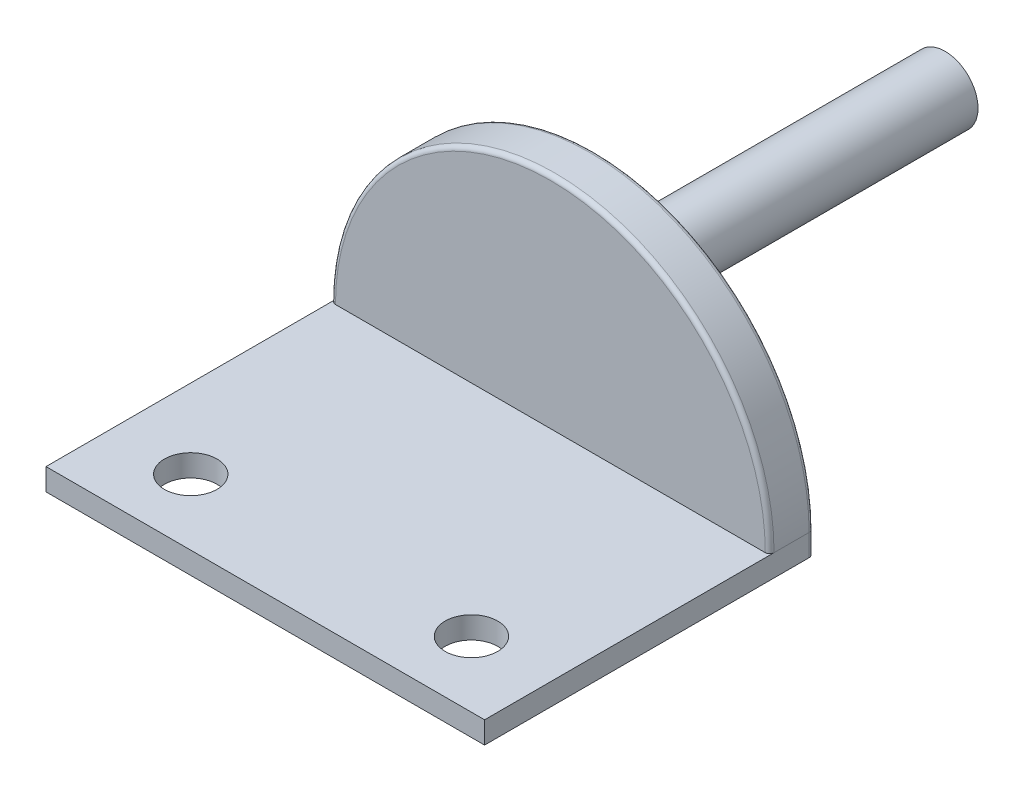
from build123d import *

# Parameters (mm, degrees)
SKETCH2_W           = 100
SKETCH2_H           = 75
SKETCH2_R           = 6
BOSS_EXTRUDE1_DEPTH = 5
SKETCH3_W           = 100
SKETCH3_H           = 10
BOSS_EXTRUDE2_DEPTH = 50
CUT_EXTRUDE2_START  = -10
CUT_EXTRUDE2_DEPTH  = 10
FILLET1_R           = 1
FILLET2_R           = 1
SKETCH6_R           = 7.5
BOSS_EXTRUDE3_DEPTH = 90


# Read off the part's stored shape, not the designer's step: Cut-Extrude2
with BuildPart() as part:
    # Sketch2 → Boss-Extrude1 (new body)
    with BuildSketch(Plane(origin=(0, 0, 0), x_dir=(1, 0, 0), z_dir=(0, 1, 0))):
        Rectangle(SKETCH2_W, SKETCH2_H)
        with Locations(Location((-32, -22.5, 0), (0, 0, 270))):
            Circle(SKETCH2_R, mode=Mode.SUBTRACT)
        with Locations(Location((32, -22.5, 0), (0, 0, 270))):
            Circle(SKETCH2_R, mode=Mode.SUBTRACT)
    extrude(amount=BOSS_EXTRUDE1_DEPTH)

    # Sketch3 → Boss-Extrude2 (add)
    with BuildSketch(Plane(origin=(0, 5, 0), x_dir=(1, 0, 0), z_dir=(0, 1, 0))):
        with Locations((0, 32.5)):
            Rectangle(SKETCH3_W, SKETCH3_H)
    extrude(amount=BOSS_EXTRUDE2_DEPTH)

    # Cut-Extrude2 outline → Cut-Extrude2 (cut)
    with BuildSketch(Plane.XY.offset(-27.5).offset(CUT_EXTRUDE2_START)):
        with BuildLine():
            Line((-50, 55), (-50, 5))
            ThreePointArc((-50, 5), (-35.355339097, 40.355339022), (-1.05e-07, 55))
            Line((-1.05e-07, 55), (-50, 55))
        make_face()
        with BuildLine():
            Line((50, 55), (-1.05e-07, 55))
            ThreePointArc((-1.05e-07, 55), (35.355339022, 40.355339097), (50, 5))
            Line((50, 5), (50, 55))
        make_face()
    extrude(amount=CUT_EXTRUDE2_DEPTH, mode=Mode.SUBTRACT)

    # Fillet1
    fillet1_edges = [part.edges().sort_by_distance(p)[0] for p in [
        (-50, 2.5, -37.5),
        (50, 2.5, -37.5),
        (35.355339022, 40.355339097, -37.5),
    ]]
    fillet(fillet1_edges, radius=FILLET1_R)

    # Fillet2
    fillet2_edges = [part.edges().sort_by_distance(p)[0] for p in [
        (35.355339022, 40.355339097, -27.5),
    ]]
    fillet(fillet2_edges, radius=FILLET2_R)

    # Sketch6 → Boss-Extrude3 (add)
    with BuildSketch(Plane.XY.offset(-27.5)):
        with Locations((0, 27)):
            Circle(SKETCH6_R)
    extrude(amount=-BOSS_EXTRUDE3_DEPTH)


solid = part.part
